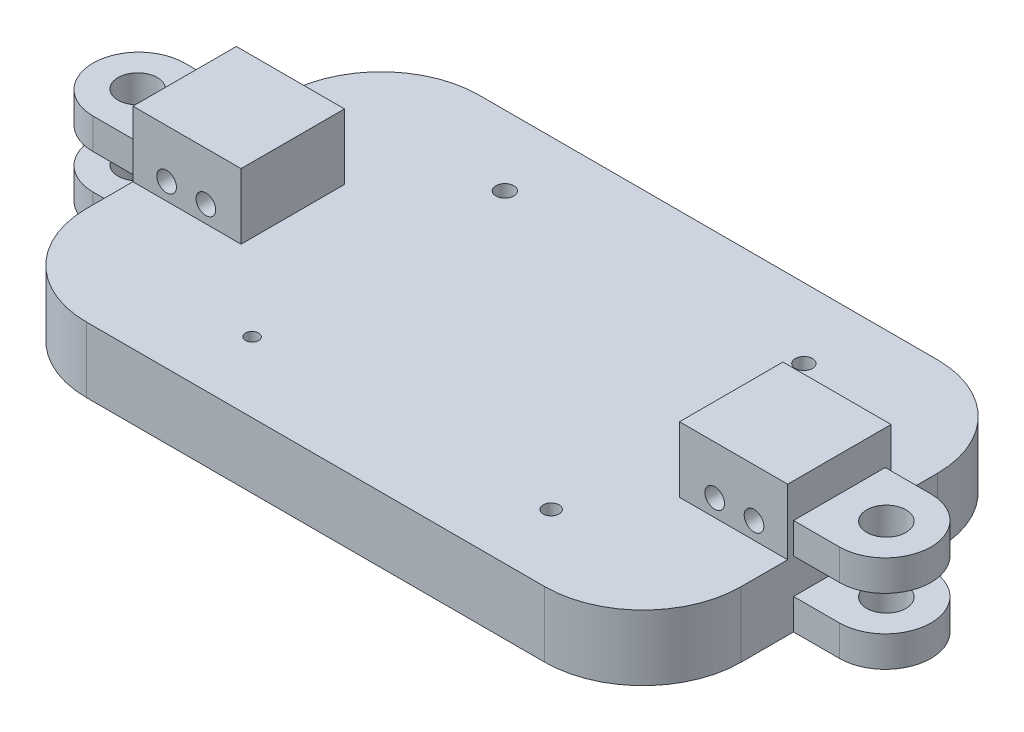
from build123d import *

# Parameters (mm, degrees)
SKETCH1_W                 = 127
SKETCH1_H                 = 76.2
BOSS_EXTRUDE1_DEPTH       = 12.7
BOSS_EXTRUDE2_DEPTH       = 12.7
BOSS_EXTRUDE2_DEPTH_BACK  = 12.7
SKETCH3_R                 = 3.81
CUT_EXTRUDE1_DEPTH        = 29.464
SKETCH4_W                 = 17.78
SKETCH4_H                 = 6.604
CUT_EXTRUDE2_DEPTH        = 29.464
BOSS_EXTRUDE3_START       = -12.7
BOSS_EXTRUDE3_OUTLINE_W   = 57.78
BOSS_EXTRUDE3_OUTLINE_H   = 32.76
BOSS_EXTRUDE3_OUTLINE_W_2 = 40
BOSS_EXTRUDE3_OUTLINE_H_2 = 20.06
BOSS_EXTRUDE3_DEPTH       = 45.5
CUT_EXTRUDE5_DEPTH        = 44.196
SKETCH10_W                = 20.976278311
SKETCH10_H                = 20.06
BOSS_EXTRUDE5_DEPTH       = 12.7
CUT_EXTRUDE7_DEPTH        = 187.177258339
CUT_EXTRUDE7_DEPTH_BACK   = 76.2
SKETCH11_W                = 20.06
SKETCH11_H                = 7.443830751
SPLIT1_START              = 12.7
SPLIT1_OUTLINE_W          = 57.78
SPLIT1_OUTLINE_H          = 32.76
SPLIT1_OUTLINE_W_2        = 40
SPLIT1_OUTLINE_H_2        = 20.06
SPLIT1_DEPTH              = 45.5
CUT_EXTRUDE9_DEPTH        = 24.384
SKETCH13_R                = 1.905
CUT_EXTRUDE10_DEPTH       = 36.83
SKETCH14_W                = 17.78
SKETCH14_H                = 0.127
CUT_EXTRUDE11_DEPTH       = 98.260775753
SKETCH15_W                = 17.78
SKETCH15_H                = 0.0635
CUT_EXTRUDE12_DEPTH       = 98.260775753
SKETCH16_W                = 17.78
SKETCH16_H                = 0.0635
CUT_EXTRUDE13_DEPTH       = 98.260775753
SKETCH17_W                = 17.78
SKETCH17_H                = 0.127
CUT_EXTRUDE14_DEPTH       = 98.260775753
SKETCH18_W                = 17.78
SKETCH18_H                = 0.0635
CUT_EXTRUDE15_DEPTH       = 98.260775753
SKETCH19_R                = 1.671154259
SKETCH19_R_2              = 1.733603543
SKETCH19_R_3              = 1.269040072
SKETCH19_R_4              = 1.545344409
CUT_EXTRUDE16_DEPTH       = 94.290987775


# Read off the part's stored shape, not the designer's step: Boss-Extrude3, Split1
with BuildPart() as part:
    # Sketch1 → Boss-Extrude1 (new body)
    with BuildSketch(Plane(origin=(0, 0, 0), x_dir=(1, 0, 0), z_dir=(0, 1, 0))):
        Rectangle(SKETCH1_W, SKETCH1_H)
    extrude(amount=BOSS_EXTRUDE1_DEPTH)

    # Sketch2 → Boss-Extrude2 (add, two sides: drawn at the far end of the back side and taken through both)
    with BuildSketch(Plane(origin=(0, 12.7, 0), x_dir=(1, 0, 0), z_dir=(0, 1, 0)).offset(-BOSS_EXTRUDE2_DEPTH_BACK)):
        with BuildLine():
            Line((72.39, 8.89), (63.5, 8.89))
            Line((63.5, 8.89), (48.26, 8.89))
            Line((48.26, 8.89), (48.26, -8.89))
            Line((48.26, -8.89), (63.5, -8.89))
            Line((63.5, -8.89), (72.39, -8.89))
            ThreePointArc((72.39, -8.89), (81.28, 0), (72.39, 8.89))
        make_face()
        with BuildLine():
            Line((-48.26, -8.89), (-63.5, -8.89))
            Line((-63.5, -8.89), (-72.39, -8.89))
            ThreePointArc((-72.39, -8.89), (-81.28, 0), (-72.39, 8.89))
            Line((-72.39, 8.89), (-63.5, 8.89))
            Line((-63.5, 8.89), (-48.26, 8.89))
            Line((-48.26, 8.89), (-48.26, -8.89))
        make_face()
    extrude(amount=BOSS_EXTRUDE2_DEPTH + BOSS_EXTRUDE2_DEPTH_BACK)

    # Sketch3 → Cut-Extrude1 (cut)
    with BuildSketch(Plane(origin=(0, 25.4, 0), x_dir=(1, 0, 0), z_dir=(0, 1, 0))):
        with Locations(Location((72.613721689, 0, 0), (0, 0, 270))):
            Circle(SKETCH3_R)
        with Locations(Location((-72.613721689, 0, 0), (0, 0, 90))):
            Circle(SKETCH3_R)
    extrude(amount=-CUT_EXTRUDE1_DEPTH, mode=Mode.SUBTRACT)

    # Sketch4 → Cut-Extrude2 (cut)
    with BuildSketch(Plane.XY.offset(8.89)):
        with Locations((72.39, 22.098)):
            Rectangle(SKETCH4_W, SKETCH4_H)
        with Locations((72.39, 9.398)):
            Rectangle(SKETCH4_W, SKETCH4_H)
        with Locations((-72.39, 9.398)):
            Rectangle(SKETCH4_W, SKETCH4_H)
        with Locations((-72.39, 22.098)):
            Rectangle(SKETCH4_W, SKETCH4_H)
    extrude(amount=-CUT_EXTRUDE2_DEPTH, mode=Mode.SUBTRACT)



with BuildPart() as body_2:
    # Boss-Extrude3 outline → Boss-Extrude3 (new body)
    with BuildSketch(Plane(origin=(0, 25.4, 0), x_dir=(1, 0, 0), z_dir=(0, 1, 0)).offset(BOSS_EXTRUDE3_START)):
        with Locations((62.523721689, 0)):
            Rectangle(BOSS_EXTRUDE3_OUTLINE_W, BOSS_EXTRUDE3_OUTLINE_H)
        with Locations((62.523721689, 0)):
            Rectangle(BOSS_EXTRUDE3_OUTLINE_W_2, BOSS_EXTRUDE3_OUTLINE_H_2, mode=Mode.SUBTRACT)
    extrude(amount=BOSS_EXTRUDE3_DEPTH)

    # Sketch7 → Cut-Extrude5 (cut)
    with BuildSketch(Plane.XY.offset(16.38)):
        with BuildLine():
            Line((91.413721689, 45.5), (91.413721689, 12.7))
            Line((91.413721689, 12.7), (63.5, 12.7))
            add(Edge.make_bspline(
                [(91.413721689, 45.5), (71.582716482, 29.1), (63.5, 12.7)],
                knots=[0, 0, 0, 1, 1, 1], degree=2, weights=[1, 3, 1]))
        make_face()
    extrude(amount=-CUT_EXTRUDE5_DEPTH, mode=Mode.SUBTRACT)


with BuildPart() as part_1:
    add(part.part)

    add(body_2.part)  # Boss-Extrude5 merges body 2
    # Sketch10 → Boss-Extrude5 (add)
    with BuildSketch(Plane(origin=(0, 12.7, 0), x_dir=(1, 0, 0), z_dir=(0, 1, 0))):
        with Locations((53.011860845, 0)):
            Rectangle(SKETCH10_W, SKETCH10_H)
        with Locations((-53.011860845, 0)):
            Rectangle(SKETCH10_W, SKETCH10_H)
    extrude(amount=BOSS_EXTRUDE5_DEPTH)

    # Sketch11 → Cut-Extrude7 (cut, two sides: drawn at the far end of the back side and taken through both)
    with BuildSketch(Plane(origin=(91.413721689, 0, 0), x_dir=(0, 0, -1), z_dir=(1, 0, 0)).offset(-CUT_EXTRUDE7_DEPTH_BACK)):
        with Locations((0, 41.778084624)):
            Rectangle(SKETCH11_W, SKETCH11_H)
    extrude(amount=CUT_EXTRUDE7_DEPTH + CUT_EXTRUDE7_DEPTH_BACK, mode=Mode.SUBTRACT)

    # Split1 outline → Split1 (cut)
    with BuildSketch(Plane(origin=(0, 0, 0), x_dir=(1, 0, 0), z_dir=(0, 1, 0)).offset(SPLIT1_START)):
        with Locations((62.523721689, 0)):
            Rectangle(SPLIT1_OUTLINE_W, SPLIT1_OUTLINE_H)
        with Locations((62.523721689, 0)):
            Rectangle(SPLIT1_OUTLINE_W_2, SPLIT1_OUTLINE_H_2, mode=Mode.SUBTRACT)
    extrude(amount=SPLIT1_DEPTH, mode=Mode.SUBTRACT)

    # Sketch12 → Cut-Extrude9 (cut)
    with BuildSketch(Plane(origin=(0, 12.7, 0), x_dir=(1, 0, 0), z_dir=(0, 1, 0))):
        with BuildLine():
            Line((63.5, 38.1), (44.45, 38.1))
            ThreePointArc((44.45, 38.1), (57.920384182, 32.520384182), (63.5, 19.05))
            Line((63.5, 19.05), (63.5, 38.1))
        make_face()
        with BuildLine():
            Line((63.5, -38.1), (63.5, -19.05))
            ThreePointArc((63.5, -19.05), (57.920384182, -32.520384182), (44.45, -38.1))
            Line((44.45, -38.1), (63.5, -38.1))
        make_face()
        with BuildLine():
            Line((-63.5, -38.1), (-44.45, -38.1))
            ThreePointArc((-44.45, -38.1), (-57.920384182, -32.520384182), (-63.5, -19.05))
            Line((-63.5, -19.05), (-63.5, -38.1))
        make_face()
        with BuildLine():
            ThreePointArc((-63.5, 19.05), (-57.920384182, 32.520384182), (-44.45, 38.1))
            Line((-44.45, 38.1), (-63.5, 38.1))
            Line((-63.5, 38.1), (-63.5, 19.05))
        make_face()
    extrude(amount=-CUT_EXTRUDE9_DEPTH, mode=Mode.SUBTRACT)

    # Sketch13 → Cut-Extrude10 (cut)
    with BuildSketch(Plane(origin=(0, 0, -10.03), x_dir=(-1, 0, 0), z_dir=(0, 0, -1))):
        with Locations((56.9735, 16.002)):
            Circle(SKETCH13_R)
        with Locations((49.3535, 16.002)):
            Circle(SKETCH13_R)
    cut_extrude10 = extrude(amount=-CUT_EXTRUDE10_DEPTH, mode=Mode.SUBTRACT)

    # Mirror1: Cut-Extrude10 across plane
    add(cut_extrude10.mirror(Plane(origin=(0, 0, 0), x_dir=(0, 0, 1), z_dir=(1, 0, 0))), mode=Mode.SUBTRACT)

    # Sketch14 → Cut-Extrude11 (cut, through all)
    with BuildSketch(Plane(origin=(0, 0, -8.89), x_dir=(-1, 0, 0), z_dir=(0, 0, -1))):
        with Locations((72.39, 6.0325)):
            Rectangle(SKETCH14_W, SKETCH14_H)
    extrude(amount=-CUT_EXTRUDE11_DEPTH, mode=Mode.SUBTRACT)

    # Sketch15 → Cut-Extrude12 (cut, through all)
    with BuildSketch(Plane(origin=(0, 0, -8.89), x_dir=(-1, 0, 0), z_dir=(0, 0, -1))):
        with Locations((72.39, 18.76425)):
            Rectangle(SKETCH15_W, SKETCH15_H)
    extrude(amount=-CUT_EXTRUDE12_DEPTH, mode=Mode.SUBTRACT)

    # Sketch16 → Cut-Extrude13 (cut, through all)
    with BuildSketch(Plane(origin=(0, 0, -8.89), x_dir=(-1, 0, 0), z_dir=(0, 0, -1))):
        with Locations((72.39, 12.73175)):
            Rectangle(SKETCH16_W, SKETCH16_H)
    extrude(amount=-CUT_EXTRUDE13_DEPTH, mode=Mode.SUBTRACT)

    # Sketch17 → Cut-Extrude14 (cut, through all)
    with BuildSketch(Plane(origin=(0, 0, -8.89), x_dir=(-1, 0, 0), z_dir=(0, 0, -1))):
        with Locations((-72.39, 6.0325)):
            Rectangle(SKETCH17_W, SKETCH17_H)
    extrude(amount=-CUT_EXTRUDE14_DEPTH, mode=Mode.SUBTRACT)

    # Sketch18 → Cut-Extrude15 (cut, through all)
    with BuildSketch(Plane(origin=(0, 0, -8.89), x_dir=(-1, 0, 0), z_dir=(0, 0, -1))):
        with Locations((-72.39, 12.73175)):
            Rectangle(SKETCH18_W, SKETCH18_H)
        with Locations((-72.39, 18.76425)):
            Rectangle(SKETCH18_W, SKETCH18_H)
    extrude(amount=-CUT_EXTRUDE15_DEPTH, mode=Mode.SUBTRACT)

    # Sketch19 → Cut-Extrude16 (cut, through all)
    with BuildSketch(Plane(origin=(0, 0, 0), x_dir=(-1, 0, 0), z_dir=(0, -1, 0))):
        with Locations(Location((-32.09925, 24.511, 0), (0, 0, 90))):
            Circle(SKETCH19_R)
        with Locations(Location((25.90074068, 24.511, 0), (0, 0, 90))):
            Circle(SKETCH19_R_2)
        with Locations(Location((25.90074068, -24.511, 0), (0, 0, 90))):
            Circle(SKETCH19_R_3)
        with Locations(Location((-32.09925, -24.511, 0), (0, 0, 90))):
            Circle(SKETCH19_R_4)
    extrude(amount=-CUT_EXTRUDE16_DEPTH, mode=Mode.SUBTRACT)


solid = part_1.part
